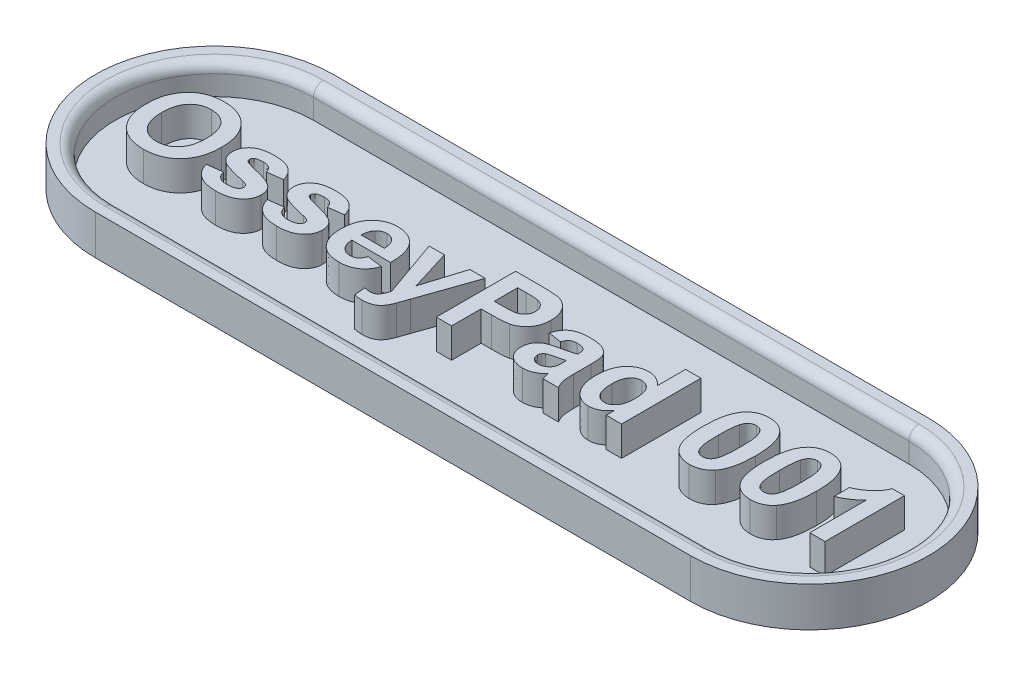
from build123d import *

# Parameters (mm, degrees)
BOSS_EXTRUDE1_DEPTH = 2
CUT_EXTRUDE1_DEPTH  = 1.5
BOSS_EXTRUDE2_DEPTH = 1.5
FILLET1_R           = 0.5


with BuildPart() as part:
    # Sketch1 → Boss-Extrude1 (new body)
    with BuildSketch(Plane(origin=(0, 0, 0), x_dir=(1, 0, 0), z_dir=(0, 1, 0))):
        with BuildLine():
            Line((-15, 6), (15, 6))
            ThreePointArc((15, 6), (21, 0), (15, -6))
            Line((15, -6), (-15, -6))
            ThreePointArc((-15, -6), (-21, 0), (-15, 6))
        make_face()
    extrude(amount=BOSS_EXTRUDE1_DEPTH)

    # Sketch2 → Cut-Extrude1 (cut)
    with BuildSketch(Plane(origin=(0, 2, 0), x_dir=(1, 0, 0), z_dir=(0, 1, 0))):
        with BuildLine():
            Line((-15, 5), (15, 5))
            ThreePointArc((15, 5), (20, 0), (15, -5))
            Line((15, -5), (-15, -5))
            ThreePointArc((-15, -5), (-20, 0), (-15, 5))
        make_face()
    extrude(amount=-CUT_EXTRUDE1_DEPTH, mode=Mode.SUBTRACT)

    # Sketch3 → Boss-Extrude2 (add)
    # profile 1 of 11: a face of its own
    with BuildSketch(Plane(origin=(0, 0.5, 0), x_dir=(1, 0, 0), z_dir=(0, 1, 0))):
        with BuildLine():
            add(Edge.make_bspline(
                [(-18.435897436, -0.019038462), (-18.435614372, 0.030391888), (-18.435058472, 0.127466713), (-18.425426006, 0.269879126), (-18.412729667, 0.406386741), (-18.392053698, 0.536452624), (-18.36773121, 0.660685527), (-18.337310232, 0.779048573), (-18.300663727, 0.891126668), (-18.271511143, 0.96268732), (-18.257211538, 0.997788462)],
                knots=[0, 0, 0, 0, 1.141009212, 2.240794809, 3.294380675, 4.305229195, 5.280013876, 6.216333343, 7.125095522, 8, 8, 8, 8], degree=3))
            add(Edge.make_bspline(
                [(-18.257211538, 0.997788462), (-18.233837113, 1.047688799), (-18.187363182, 1.146902566), (-18.10105379, 1.287099593), (-18.003227182, 1.41931675), (-17.894688739, 1.542860898), (-17.778209481, 1.655872151), (-17.653239913, 1.752593511), (-17.52421983, 1.836291465), (-17.43245726, 1.87838656), (-17.387019231, 1.899230769)],
                knots=[0, 0, 0, 0, 1.031372299, 2.050613973, 3.077158538, 4.108712802, 5.127684358, 6.111366908, 7.06480644, 8, 8, 8, 8], degree=3))
            add(Edge.make_bspline(
                [(-17.387019231, 1.899230769), (-17.356176067, 1.911881947), (-17.293834169, 1.937453202), (-17.196947521, 1.969367469), (-17.09638472, 1.995296368), (-16.992873129, 2.018473783), (-16.885407739, 2.034455374), (-16.774856913, 2.047855388), (-16.660615646, 2.054878568), (-16.583341404, 2.055809135), (-16.544070513, 2.056282051)],
                knots=[0, 0, 0, 0, 0.92659354, 1.872881803, 2.832850937, 3.813025581, 4.820167273, 5.851730198, 6.908245912, 8, 8, 8, 8], degree=3))
            add(Edge.make_bspline(
                [(-16.544070513, 2.056282051), (-16.473752941, 2.054519421), (-16.336140487, 2.051069928), (-16.135127335, 2.026154655), (-15.944907861, 1.984082923), (-15.76612596, 1.923273675), (-15.597240232, 1.847260796), (-15.439562816, 1.752975475), (-15.292860348, 1.641438169), (-15.157416176, 1.51417841), (-15.035438998, 1.371417983), (-14.929207009, 1.214490481), (-14.840092733, 1.044131281), (-14.766701981, 0.860810413), (-14.710306718, 0.663929092), (-14.669561193, 0.454042839), (-14.645355053, 0.230997055), (-14.642494663, 0.077977768), (-14.641025641, -0.000608974)],
                knots=[0, 0, 0, 0, 1.064641025, 2.083517118, 3.061799897, 4.009540929, 4.938075217, 5.861300345, 6.78508344, 7.723570974, 8.670267188, 9.622657076, 10.586935816, 11.576069104, 12.607749008, 13.683335114, 14.81022093, 16, 16, 16, 16], degree=3))
            add(Edge.make_bspline(
                [(-14.641025641, -0.000608974), (-14.642460733, -0.078669488), (-14.645254589, -0.230638725), (-14.669912552, -0.451934259), (-14.708968828, -0.660290436), (-14.766728631, -0.855231293), (-14.837928977, -1.038244361), (-14.927960262, -1.207149806), (-15.031967432, -1.36418805), (-15.153771364, -1.505410123), (-15.286935934, -1.633400225), (-15.433452317, -1.743633941), (-15.589981919, -1.838047013), (-15.757946851, -1.914279558), (-15.936252349, -1.97383646), (-16.125480301, -2.016231483), (-16.325727758, -2.041050879), (-16.462804031, -2.044512896), (-16.532852564, -2.046282051)],
                knots=[0, 0, 0, 0, 1.18845052, 2.313691126, 3.386664782, 4.412527756, 5.405809582, 6.372003093, 7.321919452, 8.268293321, 9.206237639, 10.129603466, 11.054616372, 11.9847576, 12.932764752, 13.912672021, 14.933336461, 16, 16, 16, 16], degree=3))
            add(Edge.make_bspline(
                [(-16.532852564, -2.046282051), (-16.603701235, -2.044508814), (-16.742372437, -2.041038078), (-16.94475572, -2.01629423), (-17.135862082, -1.973885252), (-17.315555438, -1.914118857), (-17.48506133, -1.839044378), (-17.642814776, -1.745596071), (-17.788902977, -1.634664224), (-17.923180215, -1.508180678), (-18.044908831, -1.367373801), (-18.148768325, -1.211345269), (-18.238804305, -1.044089607), (-18.310378988, -0.863073293), (-18.367820729, -0.670158752), (-18.406972441, -0.464235937), (-18.431678084, -0.245871605), (-18.434465278, -0.096031531), (-18.435897436, -0.019038462)],
                knots=[0, 0, 0, 0, 1.080878253, 2.11558926, 3.1052859, 4.062802436, 5.000434901, 5.928596448, 6.853693179, 7.793554778, 8.738606028, 9.68692032, 10.647726704, 11.63151566, 12.651483354, 13.714466703, 14.825613081, 16, 16, 16, 16], degree=3))
        make_face()
        with BuildLine():
            add(Edge.make_bspline(
                [(-17.666666667, 0.007403846), (-17.665898215, -0.047926721), (-17.664410122, -0.155073313), (-17.648559966, -0.310593997), (-17.62450608, -0.455984026), (-17.589131307, -0.591078385), (-17.544442015, -0.715974806), (-17.489688367, -0.830777762), (-17.425096639, -0.935658241), (-17.348996163, -1.028402068), (-17.266661415, -1.111204428), (-17.1777884, -1.182849353), (-17.084033397, -1.244514577), (-16.983774163, -1.293199063), (-16.879097269, -1.331835528), (-16.76918945, -1.360483053), (-16.653504218, -1.376213357), (-16.574563827, -1.378469211), (-16.534455128, -1.379615385)],
                knots=[0, 0, 0, 0, 1.313550922, 2.543666373, 3.708465049, 4.810029406, 5.85539231, 6.85404609, 7.825601258, 8.772642133, 9.696587791, 10.59409323, 11.479048685, 12.35559886, 13.234601248, 14.125357077, 15.047515647, 16, 16, 16, 16], degree=3))
            add(Edge.make_bspline(
                [(-16.534455128, -1.379615385), (-16.494341027, -1.378492434), (-16.415390001, -1.376282287), (-16.299846911, -1.360230356), (-16.189721284, -1.332810725), (-16.08546024, -1.294372249), (-15.986588573, -1.244914713), (-15.8931924, -1.184631894), (-15.80581008, -1.112661016), (-15.723564952, -1.031061566), (-15.649518611, -0.937701745), (-15.585476829, -0.832839365), (-15.530750158, -0.717340126), (-15.486056159, -0.591160819), (-15.451551967, -0.454064039), (-15.428479779, -0.305977248), (-15.412501451, -0.147323872), (-15.411019428, -0.037777837), (-15.41025641, 0.018621795)],
                knots=[0, 0, 0, 0, 0.949153107, 1.868086493, 2.754172764, 3.630100905, 4.492260106, 5.365378617, 6.254840125, 7.166615376, 8.102436631, 9.067266169, 10.06813181, 11.121736829, 12.23011542, 13.408501285, 14.665770308, 16, 16, 16, 16], degree=3))
            add(Edge.make_bspline(
                [(-15.41025641, 0.018621795), (-15.411118249, 0.074476858), (-15.41278728, 0.182645496), (-15.427322822, 0.339296022), (-15.451129355, 0.485035309), (-15.484223065, 0.619825604), (-15.527958483, 0.743688626), (-15.580195321, 0.85696309), (-15.643357078, 0.959057199), (-15.715795873, 1.049918093), (-15.795952736, 1.129893197), (-15.882465829, 1.199907974), (-15.975826687, 1.258164525), (-16.075124125, 1.307179509), (-16.181391931, 1.343543547), (-16.293550177, 1.37006717), (-16.411916263, 1.386400457), (-16.493002947, 1.388527846), (-16.534455128, 1.389615385)],
                knots=[0, 0, 0, 0, 1.332337092, 2.580197383, 3.749299508, 4.852775005, 5.886662144, 6.878700295, 7.822989687, 8.743523536, 9.644687758, 10.519443927, 11.392806431, 12.264866173, 13.155606721, 14.065961015, 15.011303331, 16, 16, 16, 16], degree=3))
            add(Edge.make_bspline(
                [(-16.534455128, 1.389615385), (-16.575912549, 1.388544575), (-16.657009482, 1.38644991), (-16.775560073, 1.369846201), (-16.888071654, 1.344112915), (-16.994324441, 1.305672486), (-17.09448679, 1.257128201), (-17.18818823, 1.196923612), (-17.276167098, 1.127027656), (-17.357042143, 1.045839945), (-17.430654676, 0.954183395), (-17.493846849, 0.850841799), (-17.54773206, 0.736943776), (-17.591941752, 0.612152179), (-17.624714805, 0.476123712), (-17.649903624, 0.32977257), (-17.66404873, 0.17221295), (-17.665775266, 0.063520944), (-17.666666667, 0.007403846)],
                knots=[0, 0, 0, 0, 0.981996942, 1.920933313, 2.83127778, 3.712125466, 4.592427284, 5.463259035, 6.34592384, 7.249932058, 8.173122297, 9.125107726, 10.113123258, 11.154048744, 12.256187849, 13.424658091, 14.670364834, 16, 16, 16, 16], degree=3))
        make_face(mode=Mode.SUBTRACT)
    # profile 2 of 11: a face of its own
    with BuildSketch(Plane(origin=(0, 0.5, 0), x_dir=(1, 0, 0), z_dir=(0, 1, 0))):
        with BuildLine():
            Line((-14.282051282, -1.123205128), (-13.512820513, -1.020641026))
            add(Edge.make_bspline(
                [(-13.512820513, -1.020641026), (-13.503588992, -1.056569262), (-13.485806776, -1.125776019), (-13.440765362, -1.219861636), (-13.384300764, -1.301338096), (-13.313151957, -1.368206503), (-13.227776206, -1.420848967), (-13.126905802, -1.455961432), (-13.011987496, -1.478973479), (-12.930147888, -1.48107304), (-12.887019231, -1.482179487)],
                knots=[0, 0, 0, 0, 1.039319445, 2.001988807, 2.911187514, 3.807680854, 4.723381073, 5.705509029, 6.790826147, 8, 8, 8, 8], degree=3))
            add(Edge.make_bspline(
                [(-12.887019231, -1.482179487), (-12.839880641, -1.481347743), (-12.75121902, -1.479783339), (-12.62828516, -1.458072396), (-12.521475317, -1.427913994), (-12.462819321, -1.391852021), (-12.435096154, -1.374807692)],
                knots=[0, 0, 0, 0, 1.198418162, 2.254070348, 3.174803892, 4, 4, 4, 4], degree=3))
            add(Edge.make_bspline(
                [(-12.435096154, -1.374807692), (-12.419283009, -1.361970451), (-12.388529775, -1.337004722), (-12.357321655, -1.286774029), (-12.336548638, -1.231639984), (-12.33442565, -1.192316164), (-12.333333333, -1.172083333)],
                knots=[0, 0, 0, 0, 1.030872991, 2.004830756, 2.973448591, 4, 4, 4, 4], degree=3))
            add(Edge.make_bspline(
                [(-12.333333333, -1.172083333), (-12.333856942, -1.158391082), (-12.334879677, -1.131646774), (-12.345581427, -1.093401245), (-12.363543317, -1.058834225), (-12.380204244, -1.039316175), (-12.388621795, -1.029455128)],
                knots=[0, 0, 0, 0, 1.045349703, 2.041822997, 3.010676005, 4, 4, 4, 4], degree=3))
            add(Edge.make_bspline(
                [(-12.388621795, -1.029455128), (-12.400894011, -1.020176849), (-12.429419818, -0.998610215), (-12.486486698, -0.974387347), (-12.560350945, -0.950824332), (-12.616066184, -0.937439697), (-12.646634615, -0.930096154)],
                knots=[0, 0, 0, 0, 0.66031085, 1.534841007, 2.647478808, 4, 4, 4, 4], degree=3))
            add(Edge.make_bspline(
                [(-12.646634615, -0.930096154), (-12.721227082, -0.913856878), (-12.863234827, -0.882940846), (-13.065131088, -0.833755569), (-13.245525882, -0.786146435), (-13.404870539, -0.739742648), (-13.542613402, -0.694923944), (-13.658764318, -0.649630758), (-13.754504942, -0.607412605), (-13.808485703, -0.574545067), (-13.832532051, -0.559903846)],
                knots=[0, 0, 0, 0, 1.469089687, 2.796825535, 3.998745421, 5.059265209, 5.990657066, 6.784841839, 7.458693894, 8, 8, 8, 8], degree=3))
            add(Edge.make_bspline(
                [(-13.832532051, -0.559903846), (-13.859964203, -0.539907491), (-13.913524548, -0.500865288), (-13.984866571, -0.433639585), (-14.045359316, -0.360546964), (-14.094819935, -0.281361418), (-14.132571634, -0.196272563), (-14.160176726, -0.105675334), (-14.176162186, -0.00918622), (-14.178365399, 0.057025188), (-14.179487179, 0.090737179)],
                knots=[0, 0, 0, 0, 1.056974227, 2.063706289, 3.045111424, 4.005796011, 4.963194591, 5.937303459, 6.949763919, 8, 8, 8, 8], degree=3))
            add(Edge.make_bspline(
                [(-14.179487179, 0.090737179), (-14.178506217, 0.121498882), (-14.176568673, 0.18225772), (-14.162944075, 0.271321), (-14.139429164, 0.356527801), (-14.106303269, 0.437978804), (-14.063838597, 0.515676427), (-14.01177776, 0.589438857), (-13.95059227, 0.658997097), (-13.880735197, 0.725331941), (-13.800596308, 0.785410533), (-13.709942495, 0.837752256), (-13.608876063, 0.881946689), (-13.497571662, 0.917352533), (-13.376215124, 0.945612476), (-13.244644555, 0.965105296), (-13.102793158, 0.977248281), (-13.004833611, 0.978640938), (-12.954326923, 0.979358974)],
                knots=[0, 0, 0, 0, 0.866638136, 1.711736386, 2.531524902, 3.351865931, 4.183724929, 5.020979167, 5.890357771, 6.790086018, 7.73080449, 8.705352504, 9.73310627, 10.832638366, 11.99182341, 13.240303911, 14.577136024, 16, 16, 16, 16], degree=3))
            add(Edge.make_bspline(
                [(-12.954326923, 0.979358974), (-12.906231226, 0.978787995), (-12.812876493, 0.977679713), (-12.67781573, 0.967920626), (-12.552139255, 0.952611043), (-12.436468928, 0.928745967), (-12.329557347, 0.9011226), (-12.232985185, 0.864147181), (-12.144787817, 0.823597147), (-12.067292993, 0.773348808), (-11.996401025, 0.718487231), (-11.932465755, 0.656484776), (-11.873956769, 0.588615274), (-11.819228994, 0.51594747), (-11.773635709, 0.43487875), (-11.731460942, 0.349008459), (-11.695237781, 0.25654036), (-11.676321498, 0.191859255), (-11.666666667, 0.158846154)],
                knots=[0, 0, 0, 0, 1.380550213, 2.679676202, 3.885648221, 5.011984379, 6.068504557, 7.051214125, 7.977245523, 8.849391706, 9.696088241, 10.547493682, 11.400830533, 12.26732929, 13.153751704, 14.065965736, 15.012872933, 16, 16, 16, 16], degree=3))
            Line((-11.666666667, 0.158846154), (-12.435897436, 0.056282051))
            add(Edge.make_bspline(
                [(-12.435897436, 0.056282051), (-12.44353246, 0.083854631), (-12.458354073, 0.137380345), (-12.494918792, 0.209843608), (-12.540535161, 0.272350335), (-12.59595556, 0.324557028), (-12.662601034, 0.367028168), (-12.742652446, 0.394753661), (-12.834391954, 0.412839487), (-12.899739602, 0.414420424), (-12.934294872, 0.41525641)],
                knots=[0, 0, 0, 0, 1.018425325, 1.977034519, 2.876390575, 3.766006025, 4.677889232, 5.672509542, 6.769243204, 8, 8, 8, 8], degree=3))
            add(Edge.make_bspline(
                [(-12.934294872, 0.41525641), (-12.977124797, 0.414699738), (-13.056725864, 0.413665142), (-13.16586366, 0.397183454), (-13.257824114, 0.374295727), (-13.307346951, 0.345273665), (-13.330128205, 0.331923077)],
                knots=[0, 0, 0, 0, 1.252081424, 2.327041614, 3.230413832, 4, 4, 4, 4], degree=3))
            add(Edge.make_bspline(
                [(-13.330128205, 0.331923077), (-13.342456433, 0.321788731), (-13.366113605, 0.302341495), (-13.391654636, 0.264654654), (-13.407877318, 0.222890209), (-13.409454378, 0.193184234), (-13.41025641, 0.178076923)],
                knots=[0, 0, 0, 0, 1.057832138, 2.029920023, 2.998093444, 4, 4, 4, 4], degree=3))
            add(Edge.make_bspline(
                [(-13.41025641, 0.178076923), (-13.40928165, 0.165135586), (-13.407337559, 0.13932501), (-13.392990107, 0.102271577), (-13.36903332, 0.068392092), (-13.347181778, 0.050453113), (-13.335737179, 0.041057692)],
                knots=[0, 0, 0, 0, 0.958252903, 1.911167308, 2.905987877, 4, 4, 4, 4], degree=3))
            add(Edge.make_bspline(
                [(-13.335737179, 0.041057692), (-13.32494537, 0.034084736), (-13.299162077, 0.01742527), (-13.249511898, -0.002773967), (-13.18505873, -0.026047872), (-13.104980233, -0.051235356), (-13.009711848, -0.079347287), (-12.89880707, -0.10890514), (-12.772311342, -0.139825148), (-12.634515803, -0.17219658), (-12.49437076, -0.205708932), (-12.361338797, -0.242193781), (-12.239728485, -0.281613621), (-12.129457938, -0.322826732), (-12.030304296, -0.366366142), (-11.942020126, -0.41061892), (-11.864871621, -0.457567942), (-11.820191691, -0.493218242), (-11.798878205, -0.510224359)],
                knots=[0, 0, 0, 0, 0.374473465, 0.894674728, 1.558250729, 2.377018991, 3.344303564, 4.458456515, 5.727543487, 7.146141891, 8.591136569, 9.934411183, 11.172377707, 12.322386231, 13.369924362, 14.332482298, 15.204550818, 16, 16, 16, 16], degree=3))
            add(Edge.make_bspline(
                [(-11.798878205, -0.510224359), (-11.779945602, -0.527644828), (-11.742536172, -0.562066393), (-11.69542515, -0.621833436), (-11.653661961, -0.685071569), (-11.621326792, -0.754462947), (-11.595250362, -0.828189433), (-11.576771333, -0.907148599), (-11.566753507, -0.991269367), (-11.564997898, -1.048928191), (-11.564102564, -1.078333333)],
                knots=[0, 0, 0, 0, 0.971012965, 1.9186502, 2.868006896, 3.82989672, 4.803792202, 5.820095146, 6.888280979, 8, 8, 8, 8], degree=3))
            add(Edge.make_bspline(
                [(-11.564102564, -1.078333333), (-11.565295587, -1.110969704), (-11.567645823, -1.175262837), (-11.582875331, -1.270113279), (-11.609989246, -1.360922238), (-11.645666238, -1.449065327), (-11.693816672, -1.532829726), (-11.751948954, -1.613022854), (-11.819518303, -1.690582731), (-11.897996412, -1.763354566), (-11.987072109, -1.829811392), (-12.085901593, -1.888678871), (-12.195218434, -1.937522003), (-12.314399095, -1.977516026), (-12.443694139, -2.008375551), (-12.582931045, -2.030888881), (-12.732147542, -2.043256241), (-12.834914261, -2.045253714), (-12.887820513, -2.046282051)],
                knots=[0, 0, 0, 0, 0.853005228, 1.680406763, 2.502135431, 3.325285981, 4.159928718, 5.020072903, 5.910500533, 6.844018396, 7.811498054, 8.809909951, 9.84399402, 10.934451331, 12.090792638, 13.314110396, 14.617253208, 16, 16, 16, 16], degree=3))
            add(Edge.make_bspline(
                [(-12.887820513, -2.046282051), (-12.936181474, -2.045452418), (-13.030366908, -2.043836665), (-13.167786588, -2.03305919), (-13.29724265, -2.0126671), (-13.419121567, -1.98570948), (-13.533495342, -1.951546885), (-13.639918269, -1.908814847), (-13.738889811, -1.858532218), (-13.829524457, -1.799749942), (-13.912359977, -1.734491454), (-13.987982542, -1.66375026), (-14.056500913, -1.587622814), (-14.116484012, -1.50536249), (-14.170071844, -1.418252796), (-14.215427969, -1.325350699), (-14.253759352, -1.226740298), (-14.27251028, -1.158120713), (-14.282051282, -1.123205128)],
                knots=[0, 0, 0, 0, 1.275954772, 2.484986887, 3.63311568, 4.730696379, 5.776212371, 6.778566547, 7.752400714, 8.700396387, 9.623767345, 10.531135067, 11.42942751, 12.321590653, 13.213503293, 14.124285009, 15.045583181, 16, 16, 16, 16], degree=3))
        make_face()
    # profile 3 of 11: a face of its own
    with BuildSketch(Plane(origin=(0, 0.5, 0), x_dir=(1, 0, 0), z_dir=(0, 1, 0))):
        with BuildLine():
            Line((-11.205128205, -1.123205128), (-10.435897436, -1.020641026))
            add(Edge.make_bspline(
                [(-10.435897436, -1.020641026), (-10.426665915, -1.056569262), (-10.408883699, -1.125776019), (-10.363842285, -1.219861636), (-10.307377687, -1.301338096), (-10.23622888, -1.368206503), (-10.150853129, -1.420848967), (-10.049982725, -1.455961432), (-9.935064419, -1.478973479), (-9.853224811, -1.48107304), (-9.810096154, -1.482179487)],
                knots=[0, 0, 0, 0, 1.039319445, 2.001988807, 2.911187514, 3.807680854, 4.723381073, 5.705509029, 6.790826147, 8, 8, 8, 8], degree=3))
            add(Edge.make_bspline(
                [(-9.810096154, -1.482179487), (-9.762957564, -1.481347743), (-9.674295943, -1.479783339), (-9.551362083, -1.458072396), (-9.44455224, -1.427913994), (-9.385896244, -1.391852021), (-9.358173077, -1.374807692)],
                knots=[0, 0, 0, 0, 1.198418162, 2.254070348, 3.174803892, 4, 4, 4, 4], degree=3))
            add(Edge.make_bspline(
                [(-9.358173077, -1.374807692), (-9.342359932, -1.361970451), (-9.311606698, -1.337004722), (-9.280398578, -1.286774029), (-9.259625561, -1.231639984), (-9.257502573, -1.192316164), (-9.256410256, -1.172083333)],
                knots=[0, 0, 0, 0, 1.030872991, 2.004830756, 2.973448591, 4, 4, 4, 4], degree=3))
            add(Edge.make_bspline(
                [(-9.256410256, -1.172083333), (-9.256933865, -1.158391082), (-9.2579566, -1.131646774), (-9.26865835, -1.093401245), (-9.28662024, -1.058834225), (-9.303281167, -1.039316175), (-9.311698718, -1.029455128)],
                knots=[0, 0, 0, 0, 1.045349703, 2.041822997, 3.010676005, 4, 4, 4, 4], degree=3))
            add(Edge.make_bspline(
                [(-9.311698718, -1.029455128), (-9.323970934, -1.020176849), (-9.352496741, -0.998610215), (-9.409563621, -0.974387347), (-9.483427868, -0.950824332), (-9.539143107, -0.937439697), (-9.569711538, -0.930096154)],
                knots=[0, 0, 0, 0, 0.66031085, 1.534841007, 2.647478808, 4, 4, 4, 4], degree=3))
            add(Edge.make_bspline(
                [(-9.569711538, -0.930096154), (-9.644304005, -0.913856878), (-9.78631175, -0.882940846), (-9.988208011, -0.833755569), (-10.168602805, -0.786146435), (-10.327947462, -0.739742648), (-10.465690325, -0.694923944), (-10.581841241, -0.649630758), (-10.677581865, -0.607412605), (-10.731562627, -0.574545067), (-10.755608974, -0.559903846)],
                knots=[0, 0, 0, 0, 1.469089687, 2.796825535, 3.998745421, 5.059265209, 5.990657066, 6.784841839, 7.458693894, 8, 8, 8, 8], degree=3))
            add(Edge.make_bspline(
                [(-10.755608974, -0.559903846), (-10.783041126, -0.539907491), (-10.836601471, -0.500865288), (-10.907943494, -0.433639585), (-10.968436239, -0.360546964), (-11.017896858, -0.281361418), (-11.055648557, -0.196272563), (-11.083253649, -0.105675334), (-11.09923911, -0.00918622), (-11.101442322, 0.057025188), (-11.102564103, 0.090737179)],
                knots=[0, 0, 0, 0, 1.056974227, 2.063706289, 3.045111424, 4.005796011, 4.963194591, 5.937303459, 6.949763919, 8, 8, 8, 8], degree=3))
            add(Edge.make_bspline(
                [(-11.102564103, 0.090737179), (-11.10158314, 0.121498882), (-11.099645596, 0.18225772), (-11.086020998, 0.271321), (-11.062506087, 0.356527801), (-11.029380192, 0.437978804), (-10.98691552, 0.515676427), (-10.934854683, 0.589438857), (-10.873669193, 0.658997097), (-10.80381212, 0.725331941), (-10.723673231, 0.785410533), (-10.633019418, 0.837752256), (-10.531952987, 0.881946689), (-10.420648585, 0.917352533), (-10.299292047, 0.945612476), (-10.167721478, 0.965105296), (-10.025870081, 0.977248281), (-9.927910534, 0.978640938), (-9.877403846, 0.979358974)],
                knots=[0, 0, 0, 0, 0.866638136, 1.711736386, 2.531524902, 3.351865931, 4.183724929, 5.020979167, 5.890357771, 6.790086018, 7.73080449, 8.705352504, 9.73310627, 10.832638366, 11.99182341, 13.240303911, 14.577136024, 16, 16, 16, 16], degree=3))
            add(Edge.make_bspline(
                [(-9.877403846, 0.979358974), (-9.829308149, 0.978787995), (-9.735953416, 0.977679713), (-9.600892653, 0.967920626), (-9.475216179, 0.952611043), (-9.359545852, 0.928745967), (-9.252634271, 0.9011226), (-9.156062108, 0.864147181), (-9.06786474, 0.823597147), (-8.990369916, 0.773348808), (-8.919477948, 0.718487231), (-8.855542678, 0.656484776), (-8.797033692, 0.588615274), (-8.742305917, 0.51594747), (-8.696712633, 0.43487875), (-8.654537865, 0.349008459), (-8.618314704, 0.25654036), (-8.599398421, 0.191859255), (-8.58974359, 0.158846154)],
                knots=[0, 0, 0, 0, 1.380550213, 2.679676202, 3.885648221, 5.011984379, 6.068504557, 7.051214125, 7.977245523, 8.849391706, 9.696088241, 10.547493682, 11.400830533, 12.26732929, 13.153751704, 14.065965736, 15.012872933, 16, 16, 16, 16], degree=3))
            Line((-8.58974359, 0.158846154), (-9.358974359, 0.056282051))
            add(Edge.make_bspline(
                [(-9.358974359, 0.056282051), (-9.366609383, 0.083854631), (-9.381430996, 0.137380345), (-9.417995715, 0.209843608), (-9.463612084, 0.272350335), (-9.519032483, 0.324557028), (-9.585677957, 0.367028168), (-9.665729369, 0.394753661), (-9.757468877, 0.412839487), (-9.822816525, 0.414420424), (-9.857371795, 0.41525641)],
                knots=[0, 0, 0, 0, 1.018425325, 1.977034519, 2.876390575, 3.766006025, 4.677889232, 5.672509542, 6.769243204, 8, 8, 8, 8], degree=3))
            add(Edge.make_bspline(
                [(-9.857371795, 0.41525641), (-9.90020172, 0.414699738), (-9.979802787, 0.413665142), (-10.088940583, 0.397183454), (-10.180901037, 0.374295727), (-10.230423874, 0.345273665), (-10.253205128, 0.331923077)],
                knots=[0, 0, 0, 0, 1.252081424, 2.327041614, 3.230413832, 4, 4, 4, 4], degree=3))
            add(Edge.make_bspline(
                [(-10.253205128, 0.331923077), (-10.265533356, 0.321788731), (-10.289190529, 0.302341495), (-10.314731559, 0.264654654), (-10.330954241, 0.222890209), (-10.332531301, 0.193184234), (-10.333333333, 0.178076923)],
                knots=[0, 0, 0, 0, 1.057832138, 2.029920023, 2.998093444, 4, 4, 4, 4], degree=3))
            add(Edge.make_bspline(
                [(-10.333333333, 0.178076923), (-10.332358573, 0.165135586), (-10.330414482, 0.13932501), (-10.31606703, 0.102271577), (-10.292110243, 0.068392092), (-10.270258701, 0.050453113), (-10.258814103, 0.041057692)],
                knots=[0, 0, 0, 0, 0.958252903, 1.911167308, 2.905987877, 4, 4, 4, 4], degree=3))
            add(Edge.make_bspline(
                [(-10.258814103, 0.041057692), (-10.248022293, 0.034084736), (-10.222239, 0.01742527), (-10.172588821, -0.002773967), (-10.108135653, -0.026047872), (-10.028057156, -0.051235356), (-9.932788771, -0.079347287), (-9.821883993, -0.10890514), (-9.695388266, -0.139825148), (-9.557592726, -0.17219658), (-9.417447683, -0.205708932), (-9.28441572, -0.242193781), (-9.162805408, -0.281613621), (-9.052534861, -0.322826732), (-8.953381219, -0.366366142), (-8.865097049, -0.41061892), (-8.787948544, -0.457567942), (-8.743268614, -0.493218242), (-8.721955128, -0.510224359)],
                knots=[0, 0, 0, 0, 0.374473465, 0.894674728, 1.558250729, 2.377018991, 3.344303564, 4.458456515, 5.727543487, 7.146141891, 8.591136569, 9.934411183, 11.172377707, 12.322386231, 13.369924362, 14.332482298, 15.204550818, 16, 16, 16, 16], degree=3))
            add(Edge.make_bspline(
                [(-8.721955128, -0.510224359), (-8.703022526, -0.527644828), (-8.665613095, -0.562066393), (-8.618502073, -0.621833436), (-8.576738884, -0.685071569), (-8.544403716, -0.754462947), (-8.518327285, -0.828189433), (-8.499848256, -0.907148599), (-8.48983043, -0.991269367), (-8.488074821, -1.048928191), (-8.487179487, -1.078333333)],
                knots=[0, 0, 0, 0, 0.971012965, 1.9186502, 2.868006896, 3.82989672, 4.803792202, 5.820095146, 6.888280979, 8, 8, 8, 8], degree=3))
            add(Edge.make_bspline(
                [(-8.487179487, -1.078333333), (-8.48837251, -1.110969704), (-8.490722746, -1.175262837), (-8.505952254, -1.270113279), (-8.533066169, -1.360922238), (-8.568743161, -1.449065327), (-8.616893595, -1.532829726), (-8.675025877, -1.613022854), (-8.742595226, -1.690582731), (-8.821073335, -1.763354566), (-8.910149032, -1.829811392), (-9.008978516, -1.888678871), (-9.118295357, -1.937522003), (-9.237476018, -1.977516026), (-9.366771062, -2.008375551), (-9.506007968, -2.030888881), (-9.655224465, -2.043256241), (-9.757991184, -2.045253714), (-9.810897436, -2.046282051)],
                knots=[0, 0, 0, 0, 0.853005228, 1.680406763, 2.502135431, 3.325285981, 4.159928718, 5.020072903, 5.910500533, 6.844018396, 7.811498054, 8.809909951, 9.84399402, 10.934451331, 12.090792638, 13.314110396, 14.617253208, 16, 16, 16, 16], degree=3))
            add(Edge.make_bspline(
                [(-9.810897436, -2.046282051), (-9.859258397, -2.045452418), (-9.953443831, -2.043836665), (-10.090863511, -2.03305919), (-10.220319573, -2.0126671), (-10.34219849, -1.98570948), (-10.456572265, -1.951546885), (-10.562995193, -1.908814847), (-10.661966734, -1.858532218), (-10.75260138, -1.799749942), (-10.8354369, -1.734491454), (-10.911059465, -1.66375026), (-10.979577836, -1.587622814), (-11.039560935, -1.50536249), (-11.093148767, -1.418252796), (-11.138504892, -1.325350699), (-11.176836275, -1.226740298), (-11.195587203, -1.158120713), (-11.205128205, -1.123205128)],
                knots=[0, 0, 0, 0, 1.275954772, 2.484986887, 3.63311568, 4.730696379, 5.776212371, 6.778566547, 7.752400714, 8.700396387, 9.623767345, 10.531135067, 11.42942751, 12.321590653, 13.213503293, 14.124285009, 15.045583181, 16, 16, 16, 16], degree=3))
        make_face()
    # profile 4 of 11: a face of its own
    with BuildSketch(Plane(origin=(0, 0.5, 0), x_dir=(1, 0, 0), z_dir=(0, 1, 0))):
        with BuildLine():
            Line((-6.179487179, -1.071923077), (-5.41025641, -1.174487179))
            add(Edge.make_bspline(
                [(-5.41025641, -1.174487179), (-5.422838254, -1.20914502), (-5.447576842, -1.277289721), (-5.492774404, -1.374455858), (-5.543296381, -1.465142319), (-5.598899889, -1.549833641), (-5.659377993, -1.62864032), (-5.726730472, -1.699904598), (-5.797676228, -1.766279406), (-5.875182892, -1.824604191), (-5.957308426, -1.87705751), (-6.044465549, -1.922953609), (-6.137351275, -1.960331891), (-6.234559014, -1.991633673), (-6.336530004, -2.016618795), (-6.443680264, -2.034085851), (-6.555872325, -2.04469832), (-6.632454789, -2.045747489), (-6.671474359, -2.046282051)],
                knots=[0, 0, 0, 0, 1.071172907, 2.106154283, 3.1104349, 4.085737425, 5.048416355, 5.993087888, 6.932482331, 7.868664062, 8.80754521, 9.762367971, 10.726735429, 11.713584758, 12.728370439, 13.774815933, 14.866245336, 16, 16, 16, 16], degree=3))
            add(Edge.make_bspline(
                [(-6.671474359, -2.046282051), (-6.73244897, -2.044777084), (-6.850857026, -2.041854553), (-7.022165966, -2.018368995), (-7.181275551, -1.980131589), (-7.32849222, -1.926572657), (-7.463326656, -1.856316779), (-7.585981892, -1.770887167), (-7.696698473, -1.670098154), (-7.758755291, -1.592062658), (-7.790064103, -1.552692308)],
                knots=[0, 0, 0, 0, 1.150944905, 2.235047425, 3.25761485, 4.235688044, 5.185329112, 6.119879054, 7.051444229, 8, 8, 8, 8], degree=3))
            add(Edge.make_bspline(
                [(-7.790064103, -1.552692308), (-7.813170014, -1.519188378), (-7.859698573, -1.451721244), (-7.917535282, -1.34240076), (-7.966990504, -1.226915415), (-8.006389648, -1.10493441), (-8.039141254, -0.976921214), (-8.061176981, -0.842062561), (-8.073877703, -0.700641464), (-8.075894219, -0.604267599), (-8.076923077, -0.555096154)],
                knots=[0, 0, 0, 0, 0.92479112, 1.862259343, 2.806490716, 3.778329015, 4.774107667, 5.808532634, 6.881879269, 8, 8, 8, 8], degree=3))
            add(Edge.make_bspline(
                [(-8.076923077, -0.555096154), (-8.076076915, -0.49680785), (-8.07442276, -0.382860481), (-8.054838894, -0.217220041), (-8.027204936, -0.060584792), (-7.985061289, 0.085417992), (-7.932387367, 0.22245377), (-7.866279548, 0.34876033), (-7.790026011, 0.466635164), (-7.7008682, 0.572518319), (-7.603162134, 0.667723886), (-7.499184551, 0.751615965), (-7.388157067, 0.821688048), (-7.271733408, 0.880173442), (-7.14797637, 0.923951058), (-7.018434887, 0.956177131), (-6.882542557, 0.975802375), (-6.789861762, 0.978161007), (-6.742788462, 0.979358974)],
                knots=[0, 0, 0, 0, 1.222152375, 2.389176539, 3.494777592, 4.555389183, 5.572001132, 6.56945427, 7.540785438, 8.511469914, 9.46642023, 10.399267108, 11.30862844, 12.215760073, 13.126777173, 14.056336669, 15.012798191, 16, 16, 16, 16], degree=3))
            add(Edge.make_bspline(
                [(-6.742788462, 0.979358974), (-6.690103883, 0.978245071), (-6.587005685, 0.976065279), (-6.436688886, 0.9556016), (-6.294763964, 0.922316944), (-6.161694515, 0.874488801), (-6.036612813, 0.814514631), (-5.920449133, 0.740188756), (-5.813197512, 0.652189942), (-5.715122809, 0.55055571), (-5.626363532, 0.43595435), (-5.550815549, 0.306175293), (-5.487571448, 0.162559914), (-5.436298601, 0.004737951), (-5.398393184, -0.167620997), (-5.372456715, -0.354068383), (-5.357665573, -0.554587098), (-5.358529001, -0.692892511), (-5.358974359, -0.764230769)],
                knots=[0, 0, 0, 0, 0.994942504, 1.946998194, 2.860087576, 3.744358974, 4.613292, 5.475605888, 6.343365869, 7.228414471, 8.138836547, 9.075277299, 10.058013037, 11.098483422, 12.205225682, 13.387753975, 14.652597341, 16, 16, 16, 16], degree=3))
            Line((-5.358974359, -0.764230769), (-7.307692308, -0.764230769))
            add(Edge.make_bspline(
                [(-7.307692308, -0.764230769), (-7.306430775, -0.791763508), (-7.303974166, -0.845378582), (-7.294668746, -0.923749334), (-7.278559473, -0.997107978), (-7.257477652, -1.065899573), (-7.232409314, -1.130172389), (-7.200520404, -1.189309247), (-7.16378028, -1.244064576), (-7.121306381, -1.293545478), (-7.074800926, -1.33746997), (-7.0257272, -1.376071275), (-6.974160527, -1.409825053), (-6.918768647, -1.435496954), (-6.861393173, -1.45717398), (-6.801001234, -1.47106864), (-6.737997051, -1.480301614), (-6.69501317, -1.481544961), (-6.673076923, -1.482179487)],
                knots=[0, 0, 0, 0, 1.231756261, 2.398624542, 3.522625857, 4.583815436, 5.612473245, 6.600564899, 7.580690863, 8.554470542, 9.508734211, 10.435415665, 11.342824763, 12.255949018, 13.158633635, 14.07945191, 15.019874036, 16, 16, 16, 16], degree=3))
            add(Edge.make_bspline(
                [(-6.673076923, -1.482179487), (-6.64387994, -1.48088488), (-6.587329742, -1.47837742), (-6.505816434, -1.460808928), (-6.431856781, -1.429848571), (-6.364675803, -1.38668616), (-6.304898113, -1.329366423), (-6.254780714, -1.256358155), (-6.210961635, -1.169940595), (-6.190323861, -1.10567059), (-6.179487179, -1.071923077)],
                knots=[0, 0, 0, 0, 1.004430367, 1.945431754, 2.851730883, 3.749038912, 4.678525969, 5.68064125, 6.782128749, 8, 8, 8, 8], degree=3))
        make_face()
        with BuildLine():
            add(Edge.make_bspline(
                [(-6.128205128, -0.302692308), (-6.129529022, -0.27436421), (-6.132107398, -0.219193261), (-6.140517974, -0.138754154), (-6.154956078, -0.063779133), (-6.173946423, 0.006136145), (-6.19928545, 0.070130996), (-6.227575235, 0.130039606), (-6.262269047, 0.183996564), (-6.302011352, 0.231877901), (-6.343933295, 0.275642987), (-6.390274279, 0.312036491), (-6.437130475, 0.344605938), (-6.486925478, 0.370666995), (-6.539143428, 0.390577661), (-6.593608472, 0.405216492), (-6.650415746, 0.413060596), (-6.688813985, 0.414516378), (-6.708333333, 0.41525641)],
                knots=[0, 0, 0, 0, 1.317025077, 2.564998298, 3.752245872, 4.859831213, 5.924126069, 6.944952788, 7.932526842, 8.893486968, 9.832088588, 10.740700482, 11.624936399, 12.479435602, 13.343337491, 14.21592381, 15.09308328, 16, 16, 16, 16], degree=3))
            add(Edge.make_bspline(
                [(-6.708333333, 0.41525641), (-6.729193143, 0.414579294), (-6.770298439, 0.413245004), (-6.830578131, 0.404539004), (-6.887714451, 0.389097395), (-6.942142836, 0.368197959), (-6.993746644, 0.340675591), (-7.042527028, 0.3069228), (-7.088667506, 0.267362169), (-7.116469259, 0.237390667), (-7.130608974, 0.222147436)],
                knots=[0, 0, 0, 0, 1.043516863, 2.056302107, 3.038302912, 3.998520634, 4.966791607, 5.956307719, 6.960596886, 8, 8, 8, 8], degree=3))
            add(Edge.make_bspline(
                [(-7.130608974, 0.222147436), (-7.143788139, 0.20557584), (-7.170266724, 0.172281439), (-7.203849377, 0.117077998), (-7.2331022, 0.058071984), (-7.25490191, -0.006329707), (-7.274046479, -0.074039953), (-7.285276565, -0.146676948), (-7.29284166, -0.223201483), (-7.293653159, -0.275694916), (-7.294070513, -0.302692308)],
                knots=[0, 0, 0, 0, 0.903873942, 1.815995408, 2.755131859, 3.711650387, 4.716574161, 5.757841734, 6.846857195, 8, 8, 8, 8], degree=3))
            Line((-7.294070513, -0.302692308), (-6.128205128, -0.302692308))
        make_face(mode=Mode.SUBTRACT)
    # profile 5 of 11: a face of its own
    with BuildSketch(Plane(origin=(0, 0.5, 0), x_dir=(1, 0, 0), z_dir=(0, 1, 0))):
        with BuildLine():
            Line((-5.102564103, 0.928076923), (-4.333333333, 0.928076923))
            Line((-4.333333333, 0.928076923), (-3.692307692, -1.141634615))
            Line((-3.692307692, -1.141634615), (-3.051282051, 0.928076923))
            Line((-3.051282051, 0.928076923), (-2.282051282, 0.928076923))
            Line((-2.282051282, 0.928076923), (-3.25400641, -1.859583333))
            Line((-3.25400641, -1.859583333), (-3.438301282, -2.387628205))
            add(Edge.make_bspline(
                [(-3.438301282, -2.387628205), (-3.453456537, -2.425433559), (-3.481955479, -2.496525243), (-3.527377153, -2.595048236), (-3.570270905, -2.680032392), (-3.614950884, -2.751152619), (-3.65860382, -2.813347921), (-3.706447973, -2.866730369), (-3.756200941, -2.915660081), (-3.810255711, -2.958249565), (-3.869204212, -2.996023695), (-3.934189839, -3.02829271), (-4.005183048, -3.057739725), (-4.082622109, -3.080954513), (-4.16540167, -3.100958742), (-4.253787045, -3.112508809), (-4.347000031, -3.122486853), (-4.411026321, -3.1229614), (-4.443910256, -3.123205128)],
                knots=[0, 0, 0, 0, 1.442389574, 2.712364636, 3.842141792, 4.810870158, 5.685193676, 6.529785669, 7.346031511, 8.154233153, 8.962545531, 9.821428725, 10.720930479, 11.681493955, 12.682037037, 13.733651981, 14.836002494, 16, 16, 16, 16], degree=3))
            add(Edge.make_bspline(
                [(-4.443910256, -3.123205128), (-4.51167732, -3.121551977), (-4.646906127, -3.118253122), (-4.779837985, -3.093223656), (-4.846153846, -3.080737179)],
                knots=[0, 0, 0, 0, 1.002257816, 2, 2, 2, 2], degree=3))
            Line((-4.846153846, -3.080737179), (-4.897435897, -2.523044872))
            add(Edge.make_bspline(
                [(-4.897435897, -2.523044872), (-4.871045551, -2.528661351), (-4.820081387, -2.539507709), (-4.744920908, -2.550843403), (-4.67372872, -2.557389476), (-4.627415917, -2.558543301), (-4.604967949, -2.559102564)],
                knots=[0, 0, 0, 0, 1.096454798, 2.117437249, 3.087515614, 4, 4, 4, 4], degree=3))
            add(Edge.make_bspline(
                [(-4.604967949, -2.559102564), (-4.585448017, -2.55866928), (-4.547866863, -2.557835092), (-4.493278414, -2.550632323), (-4.442750478, -2.537863287), (-4.396168166, -2.520008384), (-4.352850548, -2.498612294), (-4.314003999, -2.470696751), (-4.278879333, -2.438189335), (-4.237571333, -2.386996495), (-4.192014185, -2.314596413), (-4.145094126, -2.217843648), (-4.103775694, -2.110670578), (-4.082920852, -2.03447765), (-4.072115385, -1.995)],
                knots=[0, 0, 0, 0, 0.826282398, 1.5908173, 2.325927711, 3.027474672, 3.700169566, 4.365407898, 5.04557163, 5.720354759, 7.144619778, 8.656909909, 10.267853154, 12, 12, 12, 12], degree=3))
            Line((-4.072115385, -1.995), (-5.102564103, 0.928076923))
        make_face()
    # profile 6 of 11: a face of its own
    with BuildSketch(Plane(origin=(0, 0.5, 0), x_dir=(1, 0, 0), z_dir=(0, 1, 0))):
        with BuildLine():
            Line((-1.820512821, -1.995), (-1.820512821, 2.005))
            Line((-1.820512821, 2.005), (-0.540865385, 2.005))
            add(Edge.make_bspline(
                [(-0.540865385, 2.005), (-0.482904088, 2.004936704), (-0.372046219, 2.004815641), (-0.213914173, 2.001452031), (-0.071539957, 1.99669047), (0.054865123, 1.990760147), (0.165745855, 1.981910965), (0.260604839, 1.971663747), (0.340039396, 1.960640459), (0.386816053, 1.94923283), (0.407852564, 1.944102564)],
                knots=[0, 0, 0, 0, 1.460485487, 2.793352117, 3.985295279, 5.050041172, 5.981765236, 6.787433016, 7.454681457, 8, 8, 8, 8], degree=3))
            add(Edge.make_bspline(
                [(0.407852564, 1.944102564), (0.435826008, 1.936126257), (0.491346741, 1.920295157), (0.570890637, 1.886545765), (0.647558357, 1.847432021), (0.720386654, 1.800815508), (0.789623093, 1.747523834), (0.855473477, 1.6879916), (0.918288976, 1.621950063), (0.977200619, 1.549529687), (1.031156753, 1.471095651), (1.077788411, 1.386531993), (1.116855989, 1.296206269), (1.150140917, 1.200797267), (1.174698695, 1.099282048), (1.191884675, 0.992365949), (1.203848261, 0.880002209), (1.20469532, 0.80310963), (1.205128205, 0.763814103)],
                knots=[0, 0, 0, 0, 0.907145743, 1.80047177, 2.69161667, 3.591261238, 4.495029544, 5.415863088, 6.359363025, 7.337192411, 8.326890979, 9.326929023, 10.346104993, 11.395420813, 12.477187422, 13.601053412, 14.774031606, 16, 16, 16, 16], degree=3))
            add(Edge.make_bspline(
                [(1.205128205, 0.763814103), (1.20389362, 0.704139376), (1.201516976, 0.589262252), (1.174926543, 0.42457197), (1.134369593, 0.274138014), (1.075092679, 0.139409376), (1.002821807, 0.019857357), (0.923213954, -0.087918223), (0.832313485, -0.180668899), (0.734103546, -0.259891497), (0.63031359, -0.324723985), (0.526335754, -0.37999276), (0.420767007, -0.422485161), (0.348790471, -0.440999441), (0.313301282, -0.450128205)],
                knots=[0, 0, 0, 0, 1.312386234, 2.526415563, 3.661883817, 4.733421185, 5.753802465, 6.732107337, 7.675884281, 8.604170108, 9.50284679, 10.365392406, 11.194030444, 12, 12, 12, 12], degree=3))
            add(Edge.make_bspline(
                [(0.313301282, -0.450128205), (0.28797084, -0.454946651), (0.23457729, -0.465103359), (0.149898314, -0.475227748), (0.057339603, -0.486434343), (-0.043479541, -0.493743914), (-0.152437155, -0.500589021), (-0.26949093, -0.503820822), (-0.394473583, -0.507714485), (-0.480498279, -0.50778445), (-0.524839744, -0.507820513)],
                knots=[0, 0, 0, 0, 0.735353946, 1.55003838, 2.431865514, 3.394945452, 4.432993119, 5.54609699, 6.735134699, 8, 8, 8, 8], degree=3))
            Line((-0.524839744, -0.507820513), (-1.051282051, -0.507820513))
            Line((-1.051282051, -0.507820513), (-1.051282051, -1.995))
            Line((-1.051282051, -1.995), (-1.820512821, -1.995))
        make_face()
        with BuildLine():
            Line((-1.051282051, 1.338333333), (-1.051282051, 0.158846154))
            Line((-1.051282051, 0.158846154), (-0.58974359, 0.158846154))
            add(Edge.make_bspline(
                [(-0.58974359, 0.158846154), (-0.549943086, 0.158897692), (-0.473799714, 0.158996291), (-0.364550866, 0.162535426), (-0.265658705, 0.166855596), (-0.1769166, 0.174006361), (-0.098860221, 0.183430898), (-0.030966844, 0.194703832), (0.026842659, 0.206800867), (0.089355767, 0.226847594), (0.156194777, 0.259281369), (0.227570985, 0.305896851), (0.2902749, 0.361631158), (0.342452868, 0.427089171), (0.384131512, 0.499816815), (0.413973452, 0.579068755), (0.433242364, 0.663531508), (0.435002404, 0.722041046), (0.435897436, 0.751794872)],
                knots=[0, 0, 0, 0, 1.411705958, 2.700771114, 3.876961699, 4.922619712, 5.858038221, 6.66485904, 7.363650596, 7.950905807, 8.989198271, 9.987739806, 10.967313358, 11.951275539, 12.944273208, 13.927870418, 14.946261014, 16, 16, 16, 16], degree=3))
            add(Edge.make_bspline(
                [(0.435897436, 0.751794872), (0.434637777, 0.788034566), (0.432195463, 0.858298556), (0.405263565, 0.958366204), (0.363710723, 1.049178808), (0.304301956, 1.127910777), (0.232537565, 1.194117889), (0.151877383, 1.249204559), (0.060598878, 1.287754631), (-0.004001838, 1.302691361), (-0.036858974, 1.310288462)],
                knots=[0, 0, 0, 0, 1.085904563, 2.105425768, 3.088705091, 4.068969419, 5.045188284, 6.010769642, 6.988240112, 8, 8, 8, 8], degree=3))
            add(Edge.make_bspline(
                [(-0.036858974, 1.310288462), (-0.050998151, 1.312549908), (-0.082382739, 1.317569616), (-0.134550311, 1.322808307), (-0.196264557, 1.327572891), (-0.267599868, 1.331484756), (-0.348273487, 1.33454293), (-0.438551514, 1.337222643), (-0.538196183, 1.337437923), (-0.607906635, 1.338026594), (-0.644230769, 1.338333333)],
                knots=[0, 0, 0, 0, 0.564603001, 1.253243608, 2.066786758, 3.005752288, 4.070476343, 5.250658742, 6.567396469, 8, 8, 8, 8], degree=3))
            Line((-0.644230769, 1.338333333), (-1.051282051, 1.338333333))
        make_face(mode=Mode.SUBTRACT)
    # profile 7 of 11: a face of its own
    with BuildSketch(Plane(origin=(0, 0.5, 0), x_dir=(1, 0, 0), z_dir=(0, 1, 0))):
        with BuildLine():
            Line((2.384615385, 0.056282051), (1.717948718, 0.158846154))
            add(Edge.make_bspline(
                [(1.717948718, 0.158846154), (1.727939679, 0.192636215), (1.747496781, 0.258779572), (1.783384379, 0.353563601), (1.825408393, 0.441191354), (1.87175492, 0.522709688), (1.923852054, 0.597227449), (1.980867125, 0.664938486), (2.043122358, 0.725611059), (2.110915284, 0.779714879), (2.185550169, 0.827777413), (2.268721238, 0.868524876), (2.36030384, 0.90283482), (2.46016939, 0.930407994), (2.568150339, 0.953460233), (2.685073192, 0.967572466), (2.810183814, 0.977759307), (2.896344251, 0.978815288), (2.940705128, 0.979358974)],
                knots=[0, 0, 0, 0, 1.047140172, 2.049755565, 3.008539736, 3.933190086, 4.833981818, 5.707167246, 6.560530269, 7.413560864, 8.281243119, 9.193714071, 10.161006392, 11.183910126, 12.270717139, 13.439589873, 14.681737877, 16, 16, 16, 16], degree=3))
            add(Edge.make_bspline(
                [(2.940705128, 0.979358974), (2.981043588, 0.979135013), (3.059092168, 0.978701682), (3.172161508, 0.973020535), (3.277266877, 0.96370503), (3.374270757, 0.949935065), (3.463492856, 0.933560285), (3.544648226, 0.912795274), (3.617978478, 0.888290248), (3.702706815, 0.850197668), (3.795775917, 0.796667912), (3.892913632, 0.723983807), (3.970847313, 0.641302036), (4.02242457, 0.564133761), (4.052884031, 0.494189354), (4.074377269, 0.432564215), (4.089820305, 0.360561538), (4.1050199, 0.279212234), (4.114347415, 0.188076146), (4.122765237, 0.087130903), (4.127324224, -0.023538347), (4.127904216, -0.100766005), (4.128205128, -0.140833333)],
                knots=[0, 0, 0, 0, 1.253259065, 2.424859341, 3.516580225, 4.530621704, 5.468151732, 6.333678254, 7.13150538, 7.867126506, 9.216626747, 10.459871386, 11.622324159, 12.731817101, 13.322505456, 13.989117254, 14.756090433, 15.607496751, 16.559714447, 17.600403876, 18.755039204, 20, 20, 20, 20], degree=3))
            Line((4.128205128, -0.140833333), (4.128205128, -1.039070513))
            add(Edge.make_bspline(
                [(4.128205128, -1.039070513), (4.128454299, -1.070052444), (4.128935489, -1.129883496), (4.129921885, -1.216471257), (4.134388349, -1.29658049), (4.139080965, -1.370309901), (4.144487269, -1.437947156), (4.151503045, -1.499180029), (4.160282198, -1.554273628), (4.174367146, -1.620072002), (4.197023573, -1.699903227), (4.234067161, -1.795593414), (4.278503955, -1.89526334), (4.314675738, -1.961061146), (4.333333333, -1.995)],
                knots=[0, 0, 0, 0, 1.124218554, 2.171045354, 3.141373911, 4.034856482, 4.851737235, 5.603038048, 6.270604849, 6.87504238, 8.043824301, 9.276776929, 10.59534724, 12, 12, 12, 12], degree=3))
            Line((4.333333333, -1.995), (3.564102564, -1.995))
            add(Edge.make_bspline(
                [(3.564102564, -1.995), (3.558612118, -1.979556555), (3.546581426, -1.945716803), (3.530333934, -1.888992345), (3.510862375, -1.822901474), (3.498024618, -1.775212033), (3.491185897, -1.749807692)],
                knots=[0, 0, 0, 0, 0.768508203, 1.683958961, 2.766236402, 4, 4, 4, 4], degree=3))
            add(Edge.make_bspline(
                [(3.491185897, -1.749807692), (3.488237577, -1.738592441), (3.482900874, -1.718291913), (3.475789208, -1.69068109), (3.469623797, -1.669571757), (3.465572963, -1.657651172), (3.463942308, -1.652852564)],
                knots=[0, 0, 0, 0, 1.381357368, 2.500370598, 3.396327181, 4, 4, 4, 4], degree=3))
            add(Edge.make_bspline(
                [(3.463942308, -1.652852564), (3.431400502, -1.684226412), (3.367721655, -1.745619762), (3.263866646, -1.825130329), (3.157763276, -1.893578924), (3.047687878, -1.949440812), (2.934468226, -1.993099558), (2.816983444, -2.023544177), (2.695861572, -2.042487708), (2.613583621, -2.045010539), (2.572115385, -2.046282051)],
                knots=[0, 0, 0, 0, 1.082260538, 2.117802027, 3.127898709, 4.103827344, 5.070056335, 6.029309159, 7.006768236, 8, 8, 8, 8], degree=3))
            add(Edge.make_bspline(
                [(2.572115385, -2.046282051), (2.536035229, -2.045446916), (2.465565305, -2.043815772), (2.362734494, -2.033040779), (2.266074908, -2.012604899), (2.175143828, -1.985426049), (2.089720748, -1.951256937), (2.010543736, -1.908326427), (1.937148299, -1.857597056), (1.870262942, -1.799254558), (1.810316168, -1.735220696), (1.757706123, -1.667088991), (1.714184425, -1.593945769), (1.678179124, -1.517201023), (1.649691671, -1.436182873), (1.630041248, -1.351259887), (1.61751543, -1.262198986), (1.616105419, -1.201506861), (1.615384615, -1.170480769)],
                knots=[0, 0, 0, 0, 1.186431605, 2.317277787, 3.39378889, 4.430144672, 5.434756152, 6.413230964, 7.385260177, 8.362630794, 9.325691837, 10.265445477, 11.187216893, 12.118354241, 13.048828682, 14.005299944, 14.980300216, 16, 16, 16, 16], degree=3))
            add(Edge.make_bspline(
                [(1.615384615, -1.170480769), (1.616693774, -1.129777325), (1.619262596, -1.049909339), (1.641705552, -0.933876876), (1.676850126, -0.824273278), (1.726801419, -0.722473415), (1.788955834, -0.629388657), (1.863728239, -0.547225063), (1.950041003, -0.477265688), (2.049778955, -0.417854231), (2.16675527, -0.367807245), (2.303367913, -0.319594552), (2.462943064, -0.276384636), (2.577333026, -0.25166243), (2.637820513, -0.238589744)],
                knots=[0, 0, 0, 0, 0.9565892, 1.877012003, 2.769038917, 3.656897043, 4.535078379, 5.39337207, 6.259743944, 7.138913465, 8.11486349, 9.247429708, 10.544487161, 12, 12, 12, 12], degree=3))
            add(Edge.make_bspline(
                [(2.637820513, -0.238589744), (2.679500673, -0.230108451), (2.759733514, -0.21378226), (2.874984155, -0.189235212), (2.980274665, -0.164493682), (3.07515822, -0.13935931), (3.160638213, -0.116523087), (3.235822503, -0.093511424), (3.301007767, -0.070351347), (3.340603626, -0.053910076), (3.358974359, -0.046282051)],
                knots=[0, 0, 0, 0, 1.365613701, 2.628758346, 3.783158308, 4.837685682, 5.780080249, 6.623655076, 7.36143661, 8, 8, 8, 8], degree=3))
            Line((3.358974359, -0.046282051), (3.358974359, 0.026634615))
            add(Edge.make_bspline(
                [(3.358974359, 0.026634615), (3.357949334, 0.059324168), (3.356045804, 0.120030526), (3.337121559, 0.20420859), (3.304271102, 0.273542577), (3.264618594, 0.319753249), (3.225386348, 0.347629678), (3.190744614, 0.366182393), (3.150150864, 0.380988799), (3.104175305, 0.394112042), (3.052027778, 0.403079666), (2.994310259, 0.410526007), (2.930868026, 0.414179766), (2.886755175, 0.414887721), (2.863782051, 0.41525641)],
                knots=[0, 0, 0, 0, 1.600506204, 2.972230995, 4.195852174, 5.327580964, 5.908906329, 6.547275261, 7.247479517, 8.022494018, 8.887774365, 9.837646189, 10.873887764, 12, 12, 12, 12], degree=3))
            add(Edge.make_bspline(
                [(2.863782051, 0.41525641), (2.83325523, 0.414526972), (2.775246358, 0.413140852), (2.693498059, 0.397631942), (2.621566472, 0.37332102), (2.559216959, 0.337025356), (2.505466961, 0.2877181), (2.458663736, 0.224134958), (2.417201232, 0.145999077), (2.395885958, 0.087312773), (2.384615385, 0.056282051)],
                knots=[0, 0, 0, 0, 1.120680009, 2.129582446, 3.045508635, 3.899130849, 4.760899303, 5.707254252, 6.787697471, 8, 8, 8, 8], degree=3))
        make_face()
        with BuildLine():
            add(Edge.make_bspline(
                [(3.358974359, -0.610384615), (3.332573461, -0.618537456), (3.273111605, -0.636899826), (3.173232958, -0.663878155), (3.052843698, -0.692307188), (2.941824674, -0.716906417), (2.849147576, -0.736885805), (2.783770229, -0.753221396), (2.724857254, -0.768797855), (2.672320557, -0.785155565), (2.626089823, -0.800553548), (2.5868381, -0.817052855), (2.553199162, -0.831500397), (2.534331528, -0.84359558), (2.525641026, -0.849166667)],
                knots=[0, 0, 0, 0, 1.144223484, 2.577096135, 4.283377528, 6.266557578, 7.286341447, 8.209198618, 9.057088726, 9.80932547, 10.487940513, 11.073343897, 11.57317876, 12, 12, 12, 12], degree=3))
            add(Edge.make_bspline(
                [(2.525641026, -0.849166667), (2.504126674, -0.866111475), (2.462837978, -0.898630653), (2.417828514, -0.961473268), (2.38926718, -1.031143624), (2.386184971, -1.080462005), (2.384615385, -1.105576923)],
                knots=[0, 0, 0, 0, 1.075028234, 2.063111864, 3.013658082, 4, 4, 4, 4], degree=3))
            add(Edge.make_bspline(
                [(2.384615385, -1.105576923), (2.385999765, -1.13056573), (2.388715332, -1.179583165), (2.41034491, -1.250215357), (2.446717209, -1.314925317), (2.496255799, -1.372451934), (2.555865713, -1.422255007), (2.626132097, -1.456390387), (2.70354423, -1.478432019), (2.757852386, -1.480898503), (2.786057692, -1.482179487)],
                knots=[0, 0, 0, 0, 0.976809721, 1.916086158, 2.861451878, 3.862738809, 4.873423621, 5.878632484, 6.898253484, 8, 8, 8, 8], degree=3))
            add(Edge.make_bspline(
                [(2.786057692, -1.482179487), (2.818287112, -1.480721159), (2.883171023, -1.477785269), (2.978331824, -1.450960065), (3.072285107, -1.41136645), (3.129332935, -1.372399608), (3.158653846, -1.352371795)],
                knots=[0, 0, 0, 0, 0.962503947, 1.937702252, 2.940039444, 4, 4, 4, 4], degree=3))
            add(Edge.make_bspline(
                [(3.158653846, -1.352371795), (3.179361356, -1.335700932), (3.219623779, -1.303287118), (3.267610933, -1.244053982), (3.307210971, -1.181044051), (3.322993213, -1.134560608), (3.330929487, -1.111185897)],
                knots=[0, 0, 0, 0, 1.055399509, 2.052054707, 3.020454315, 4, 4, 4, 4], degree=3))
            add(Edge.make_bspline(
                [(3.330929487, -1.111185897), (3.335303465, -1.092017055), (3.345542374, -1.047145308), (3.352766172, -0.968150608), (3.358609771, -0.868760051), (3.358845434, -0.795496943), (3.358974359, -0.755416667)],
                knots=[0, 0, 0, 0, 0.659054705, 1.542760655, 2.655710416, 4, 4, 4, 4], degree=3))
            Line((3.358974359, -0.755416667), (3.358974359, -0.610384615))
        make_face(mode=Mode.SUBTRACT)
    # profile 8 of 11: a face of its own
    with BuildSketch(Plane(origin=(0, 0.5, 0), x_dir=(1, 0, 0), z_dir=(0, 1, 0))):
        with BuildLine():
            Line((7.512820513, -1.995), (6.743589744, -1.995))
            Line((6.743589744, -1.995), (6.743589744, -1.572724359))
            add(Edge.make_bspline(
                [(6.743589744, -1.572724359), (6.71551205, -1.612042752), (6.660938674, -1.688464179), (6.563593263, -1.786397744), (6.461369062, -1.870741314), (6.349955521, -1.934748135), (6.236123454, -1.98465635), (6.120821055, -2.0202355), (6.004553107, -2.041881819), (5.926637918, -2.04481883), (5.887820513, -2.046282051)],
                knots=[0, 0, 0, 0, 1.136300101, 2.208576455, 3.242281452, 4.249058783, 5.223933999, 6.165280663, 7.085941471, 8, 8, 8, 8], degree=3))
            add(Edge.make_bspline(
                [(5.887820513, -2.046282051), (5.849293524, -2.044988805), (5.77312965, -2.042432192), (5.660752406, -2.023881361), (5.55289576, -1.991255509), (5.449040078, -1.947138755), (5.349566758, -1.890406381), (5.254577941, -1.820902442), (5.163884962, -1.738460194), (5.077581852, -1.644604624), (4.999341333, -1.538711475), (4.92994653, -1.423099855), (4.872202693, -1.296922088), (4.825096271, -1.161087962), (4.788315997, -1.015228498), (4.762006944, -0.859584369), (4.747046692, -0.694011238), (4.744762196, -0.580500005), (4.743589744, -0.52224359)],
                knots=[0, 0, 0, 0, 0.868680302, 1.717291116, 2.559594063, 3.404262612, 4.256691068, 5.136162843, 6.05305749, 7.01654586, 8.006773995, 9.017023416, 10.051895049, 11.130067211, 12.254925639, 13.440213999, 14.686262564, 16, 16, 16, 16], degree=3))
            add(Edge.make_bspline(
                [(4.743589744, -0.52224359), (4.74475545, -0.462652373), (4.747017644, -0.347008391), (4.761899325, -0.179022039), (4.788238248, -0.022299728), (4.824997396, 0.123574131), (4.872018747, 0.25868705), (4.92979087, 0.382853457), (4.998017997, 0.495957986), (5.07700463, 0.596942549), (5.16347857, 0.686926415), (5.256670942, 0.764805259), (5.355256524, 0.831079264), (5.458858331, 0.886208627), (5.568796313, 0.928005484), (5.683911806, 0.957174319), (5.804352605, 0.976798099), (5.886671922, 0.978493618), (5.928685897, 0.979358974)],
                knots=[0, 0, 0, 0, 1.327136196, 2.575468729, 3.751890053, 4.862767969, 5.921925726, 6.933145827, 7.907387355, 8.856890668, 9.782390252, 10.681851331, 11.556239068, 12.423659137, 13.289752485, 14.16837887, 15.06518071, 16, 16, 16, 16], degree=3))
            add(Edge.make_bspline(
                [(5.928685897, 0.979358974), (5.967490675, 0.978110634), (6.043943067, 0.975651178), (6.15662213, 0.956557345), (6.265176674, 0.925602428), (6.369357149, 0.880532637), (6.470162807, 0.824414488), (6.566299834, 0.754952236), (6.658690569, 0.673360033), (6.714794896, 0.611346767), (6.743589744, 0.579519231)],
                knots=[0, 0, 0, 0, 0.992399448, 1.955205421, 2.915485871, 3.87381908, 4.85285833, 5.861755538, 6.90257267, 8, 8, 8, 8], degree=3))
            Line((6.743589744, 0.579519231), (6.743589744, 2.005))
            Line((6.743589744, 2.005), (7.512820513, 2.005))
            Line((7.512820513, 2.005), (7.512820513, -1.995))
        make_face()
        with BuildLine():
            add(Edge.make_bspline(
                [(5.512820513, -0.478173077), (5.512934906, -0.516915556), (5.513155192, -0.591521768), (5.52022738, -0.699188329), (5.529101793, -0.79848261), (5.543115806, -0.889306192), (5.559090867, -0.972336313), (5.58107084, -1.046562725), (5.605169938, -1.113287932), (5.62616685, -1.153049637), (5.636217949, -1.172083333)],
                knots=[0, 0, 0, 0, 1.306099746, 2.515150209, 3.637201974, 4.666415219, 5.613193253, 6.485405436, 7.274972403, 8, 8, 8, 8], degree=3))
            add(Edge.make_bspline(
                [(5.636217949, -1.172083333), (5.651071841, -1.196835041), (5.679813885, -1.244729198), (5.732254431, -1.307363742), (5.78712225, -1.362148498), (5.848409455, -1.405627029), (5.913293117, -1.440707947), (5.983185211, -1.464590392), (6.057046566, -1.47963087), (6.107830816, -1.481316864), (6.133814103, -1.482179487)],
                knots=[0, 0, 0, 0, 1.120960711, 2.169040953, 3.168100815, 4.128109154, 5.080726846, 6.026866003, 6.990464429, 8, 8, 8, 8], degree=3))
            add(Edge.make_bspline(
                [(6.133814103, -1.482179487), (6.154680995, -1.481276505), (6.195869678, -1.479494129), (6.256401436, -1.469348915), (6.314110973, -1.450287682), (6.369335812, -1.424475619), (6.423022003, -1.392336551), (6.473450404, -1.351730382), (6.521651619, -1.304127984), (6.567375618, -1.249675897), (6.609207712, -1.187914036), (6.645274914, -1.118482537), (6.67559138, -1.041564258), (6.70112014, -0.958040898), (6.720337083, -0.867116159), (6.733332128, -0.769329854), (6.742794559, -0.664253574), (6.743319161, -0.591711167), (6.743589744, -0.554294872)],
                knots=[0, 0, 0, 0, 0.808519481, 1.595918141, 2.367946092, 3.154732969, 3.953063559, 4.785064852, 5.655532678, 6.573390792, 7.534530006, 8.538576741, 9.596996712, 10.732480475, 11.917354949, 13.191565377, 14.551451138, 16, 16, 16, 16], degree=3))
            add(Edge.make_bspline(
                [(6.743589744, -0.554294872), (6.74322459, -0.512881099), (6.742519444, -0.432907155), (6.734434111, -0.317345138), (6.721164721, -0.210519961), (6.701975537, -0.112838565), (6.678291112, -0.023945758), (6.64867523, 0.055823075), (6.61380406, 0.12686958), (6.572421908, 0.188314384), (6.526921925, 0.241150164), (6.480123238, 0.288422651), (6.428726977, 0.327022265), (6.374976611, 0.359501993), (6.317587436, 0.384592808), (6.256914573, 0.401884236), (6.193582185, 0.413908674), (6.1501639, 0.414803734), (6.128205128, 0.41525641)],
                knots=[0, 0, 0, 0, 1.538844071, 2.971654591, 4.302575584, 5.536777829, 6.668535022, 7.717613974, 8.694219699, 9.60272161, 10.461894315, 11.283130947, 12.06930595, 12.843865074, 13.612870817, 14.388700961, 15.185086457, 16, 16, 16, 16], degree=3))
            add(Edge.make_bspline(
                [(6.128205128, 0.41525641), (6.106794843, 0.414712765), (6.0645116, 0.413639117), (6.002590536, 0.402949092), (5.943364549, 0.385231495), (5.887099641, 0.359994329), (5.832899367, 0.328600163), (5.781432298, 0.289978482), (5.733163531, 0.243654864), (5.687745552, 0.19089093), (5.645405006, 0.131741719), (5.610762263, 0.064360255), (5.579856021, -0.008859299), (5.555293922, -0.089451162), (5.536184659, -0.176828047), (5.523046876, -0.27113655), (5.513615163, -0.372213764), (5.51309111, -0.442091406), (5.512820513, -0.478173077)],
                knots=[0, 0, 0, 0, 0.844531552, 1.667868134, 2.47173451, 3.278912967, 4.096287191, 4.939765054, 5.812329042, 6.731790039, 7.685377109, 8.6758465, 9.71559549, 10.819442259, 11.996209133, 13.242749135, 14.576279701, 16, 16, 16, 16], degree=3))
        make_face(mode=Mode.SUBTRACT)
    # profile 9 of 11: a face of its own
    with BuildSketch(Plane(origin=(0, 0.5, 0), x_dir=(1, 0, 0), z_dir=(0, 1, 0))):
        with BuildLine():
            add(Edge.make_bspline(
                [(10.974358974, 2.005), (11.021972301, 2.003851597), (11.114669991, 2.001615789), (11.249740732, 1.981810576), (11.376916557, 1.950054022), (11.496188133, 1.905163882), (11.607443723, 1.84687144), (11.709942252, 1.77492759), (11.805923451, 1.691488923), (11.861349087, 1.626739134), (11.889423077, 1.593942308)],
                knots=[0, 0, 0, 0, 1.098584764, 2.138818609, 3.143716932, 4.11936356, 5.073598562, 6.034819447, 7.004603936, 8, 8, 8, 8], degree=3))
            add(Edge.make_bspline(
                [(11.889423077, 1.593942308), (11.905481848, 1.573055062), (11.938254985, 1.530427854), (11.982393033, 1.461546994), (12.024825762, 1.388479595), (12.061865392, 1.309466899), (12.097332444, 1.225880037), (12.130200315, 1.137528553), (12.158738464, 1.043682455), (12.185591193, 0.945541729), (12.207473704, 0.841573653), (12.227695169, 0.732900625), (12.244459673, 0.619029983), (12.257679473, 0.500326047), (12.269486064, 0.37696942), (12.275955504, 0.248371459), (12.281252597, 0.114819309), (12.281781991, 0.023969701), (12.282051282, -0.02224359)],
                knots=[0, 0, 0, 0, 0.746761706, 1.524009783, 2.317797294, 3.140957436, 3.996208027, 4.892396322, 5.812273159, 6.776774596, 7.776522781, 8.823794876, 9.910947555, 11.039215469, 12.21036455, 13.424061321, 14.689674014, 16, 16, 16, 16], degree=3))
            add(Edge.make_bspline(
                [(12.282051282, -0.02224359), (12.281786047, -0.068456987), (12.28126616, -0.159039866), (12.275935756, -0.292324084), (12.269480297, -0.420653924), (12.257707016, -0.544017139), (12.244360642, -0.662697477), (12.228075445, -0.776440474), (12.206332286, -0.884614146), (12.184794014, -0.9884164), (12.158098712, -1.086974982), (12.128278111, -1.180652784), (12.096731285, -1.270105654), (12.060439621, -1.35380012), (12.022070998, -1.432910593), (11.980269747, -1.5067238), (11.93563886, -1.576031544), (11.902548663, -1.618883635), (11.886217949, -1.640032051)],
                knots=[0, 0, 0, 0, 1.308387162, 2.564569672, 3.776470597, 4.945886788, 6.07248526, 7.158029334, 8.197718558, 9.195987466, 10.159061779, 11.087054987, 11.979325145, 12.84323098, 13.668471539, 14.467659354, 15.243757377, 16, 16, 16, 16], degree=3))
            add(Edge.make_bspline(
                [(11.886217949, -1.640032051), (11.858400818, -1.672547762), (11.803488459, -1.736735343), (11.708569546, -1.819482045), (11.606240937, -1.889938001), (11.495181306, -1.947072022), (11.376492532, -1.992271909), (11.249108587, -2.023015111), (11.114406845, -2.042860643), (11.021707459, -2.045125315), (10.974358974, -2.046282051)],
                knots=[0, 0, 0, 0, 0.991631672, 1.957528776, 2.911425699, 3.867574088, 4.848108326, 5.850523106, 6.902101959, 8, 8, 8, 8], degree=3))
            add(Edge.make_bspline(
                [(10.974358974, -2.046282051), (10.926469312, -2.044904043), (10.832627039, -2.042203764), (10.695613251, -2.020797886), (10.565375358, -1.986505802), (10.44238091, -1.937545849), (10.32680589, -1.874097341), (10.217747382, -1.798040078), (10.117578054, -1.705930166), (10.039156402, -1.620180919), (9.981782884, -1.542700169), (9.9413177, -1.478450358), (9.902212413, -1.409700497), (9.868459849, -1.334301118), (9.835159946, -1.254482311), (9.805666696, -1.168523868), (9.77964601, -1.077164951), (9.755214241, -0.980822729), (9.734841745, -0.878833594), (9.716102039, -0.771498518), (9.70133414, -0.658361033), (9.688240876, -0.540051301), (9.679022469, -0.416290037), (9.671535946, -0.287279772), (9.667781971, -0.152607547), (9.667043412, -0.060973958), (9.666666667, -0.014230769)],
                knots=[0, 0, 0, 0, 1.257818097, 2.464759732, 3.634271214, 4.790227596, 5.933394726, 7.09190477, 8.274482889, 9.50191983, 10.139172818, 10.805000628, 11.49619854, 12.215266328, 12.973768034, 13.768328009, 14.601232062, 15.469317089, 16.379095881, 17.333267023, 18.331755967, 19.376479622, 20.460535752, 21.592206075, 22.771760786, 24, 24, 24, 24], degree=3))
            add(Edge.make_bspline(
                [(9.666666667, -0.014230769), (9.666929784, 0.031715715), (9.66744546, 0.12176492), (9.672814735, 0.254512371), (9.679184884, 0.382315257), (9.69108631, 0.505397269), (9.704245492, 0.623570831), (9.720832428, 0.736991744), (9.742034985, 0.845073188), (9.76511998, 0.948246537), (9.790442641, 1.046877176), (9.820540462, 1.140140661), (9.851771983, 1.229447556), (9.888487821, 1.312695595), (9.926620883, 1.391639565), (9.968454844, 1.46543894), (10.013077498, 1.534750165), (10.04616876, 1.577601806), (10.0625, 1.59875)],
                knots=[0, 0, 0, 0, 1.304469132, 2.556591843, 3.77188756, 4.93702727, 6.066781583, 7.147865049, 8.190466662, 9.19316792, 10.149665317, 11.080258032, 11.975027628, 12.834388201, 13.661940433, 14.463366943, 15.241638981, 16, 16, 16, 16], degree=3))
            add(Edge.make_bspline(
                [(10.0625, 1.59875), (10.090315601, 1.631268838), (10.14522494, 1.695462595), (10.240165961, 1.778164092), (10.342607704, 1.848924167), (10.453992358, 1.90537432), (10.572409048, 1.951193878), (10.699626286, 1.981691754), (10.834306566, 2.001589665), (10.927008955, 2.003847007), (10.974358974, 2.005)],
                knots=[0, 0, 0, 0, 0.991667276, 1.957599061, 2.911530233, 3.873218945, 4.847995157, 5.850445929, 6.902062539, 8, 8, 8, 8], degree=3))
        make_face()
        with BuildLine():
            add(Edge.make_bspline(
                [(10.974358974, 1.338333333), (10.949967622, 1.337215626), (10.901719298, 1.335004699), (10.831591433, 1.318619582), (10.765361448, 1.291580568), (10.702710073, 1.253834454), (10.645021743, 1.201324417), (10.596154559, 1.130919729), (10.553951824, 1.044521501), (10.532831673, 0.979942387), (10.521634615, 0.945705128)],
                knots=[0, 0, 0, 0, 0.899391665, 1.779078861, 2.640979247, 3.529945348, 4.464599804, 5.495588918, 6.672261578, 8, 8, 8, 8], degree=3))
            add(Edge.make_bspline(
                [(10.521634615, 0.945705128), (10.51464186, 0.919872169), (10.499612577, 0.864350304), (10.482554966, 0.773826589), (10.468487905, 0.671091755), (10.456609694, 0.556169678), (10.446943334, 0.428999543), (10.440990456, 0.289500435), (10.436875935, 0.137770099), (10.436232283, 0.032513802), (10.435897436, -0.02224359)],
                knots=[0, 0, 0, 0, 0.658986521, 1.416336438, 2.266694271, 3.212608458, 4.261595115, 5.407496572, 6.651304179, 8, 8, 8, 8], degree=3))
            add(Edge.make_bspline(
                [(10.435897436, -0.02224359), (10.436353939, -0.076730097), (10.43722898, -0.181171594), (10.439713805, -0.331077209), (10.446767023, -0.467533563), (10.453826612, -0.591084451), (10.465584671, -0.701340577), (10.477410832, -0.798599667), (10.49371125, -0.882197485), (10.515952229, -0.973125137), (10.549588857, -1.068295352), (10.595737307, -1.164308131), (10.645224231, -1.241401897), (10.703510953, -1.296600519), (10.766594265, -1.333629108), (10.832024307, -1.360835958), (10.902088312, -1.376102699), (10.94998433, -1.378430665), (10.974358974, -1.379615385)],
                knots=[0, 0, 0, 0, 1.613353868, 3.092528792, 4.438413522, 5.658843895, 6.755779493, 7.721003256, 8.558527904, 9.275869043, 10.491421475, 11.538327284, 12.426656321, 13.187490948, 13.890032692, 14.581719216, 15.278226227, 16, 16, 16, 16], degree=3))
            add(Edge.make_bspline(
                [(10.974358974, -1.379615385), (10.999030839, -1.378554366), (11.047312736, -1.376477993), (11.11753248, -1.35954656), (11.183856764, -1.333320585), (11.246088925, -1.294804873), (11.303723223, -1.242654384), (11.352554733, -1.172186429), (11.394768749, -1.085808207), (11.415887185, -1.021226051), (11.427083333, -0.986987179)],
                knots=[0, 0, 0, 0, 0.909107913, 1.77908945, 2.650019014, 3.530482969, 4.465025013, 5.495890128, 6.672421267, 8, 8, 8, 8], degree=3))
            add(Edge.make_bspline(
                [(11.427083333, -0.986987179), (11.434065973, -0.961152171), (11.449005103, -0.905879017), (11.466184263, -0.815918836), (11.480289408, -0.71371637), (11.492054681, -0.599317074), (11.501816122, -0.472421638), (11.507718467, -0.33318563), (11.511836859, -0.181723194), (11.512484422, -0.076733927), (11.512820513, -0.02224359)],
                knots=[0, 0, 0, 0, 0.66114423, 1.414496391, 2.261103113, 3.210114492, 4.255954433, 5.405607896, 6.653488082, 8, 8, 8, 8], degree=3))
            add(Edge.make_bspline(
                [(11.512820513, -0.02224359), (11.512857674, 0.032248623), (11.512928912, 0.136709283), (11.508209151, 0.286805173), (11.503577119, 0.423663478), (11.494131615, 0.547016102), (11.48467111, 0.657279637), (11.470577307, 0.753902033), (11.45637891, 0.837948244), (11.432113816, 0.928686415), (11.399137356, 1.024130131), (11.354085273, 1.121140592), (11.303158564, 1.197511683), (11.245294305, 1.253648261), (11.182521492, 1.291490745), (11.116930875, 1.318780154), (11.046986575, 1.334977674), (10.998746272, 1.337206552), (10.974358974, 1.338333333)],
                knots=[0, 0, 0, 0, 1.611146624, 3.088541111, 4.440175916, 5.659517762, 6.746360572, 7.711365618, 8.546319149, 9.264661039, 10.486047304, 11.528122518, 12.419721574, 13.184982167, 13.89070983, 14.574167459, 15.279187713, 16, 16, 16, 16], degree=3))
        make_face(mode=Mode.SUBTRACT)
    # profile 10 of 11: a face of its own
    with BuildSketch(Plane(origin=(0, 0.5, 0), x_dir=(1, 0, 0), z_dir=(0, 1, 0))):
        with BuildLine():
            add(Edge.make_bspline(
                [(14.051282051, 2.005), (14.098895378, 2.003851597), (14.191593068, 2.001615789), (14.326663809, 1.981810576), (14.453839634, 1.950054022), (14.57311121, 1.905163882), (14.6843668, 1.84687144), (14.786865329, 1.77492759), (14.882846528, 1.691488923), (14.938272164, 1.626739134), (14.966346154, 1.593942308)],
                knots=[0, 0, 0, 0, 1.098584764, 2.138818609, 3.143716932, 4.11936356, 5.073598562, 6.034819447, 7.004603936, 8, 8, 8, 8], degree=3))
            add(Edge.make_bspline(
                [(14.966346154, 1.593942308), (14.982404925, 1.573055062), (15.015178062, 1.530427854), (15.05931611, 1.461546994), (15.101748839, 1.388479595), (15.138788469, 1.309466899), (15.174255521, 1.225880037), (15.207123392, 1.137528553), (15.235661541, 1.043682455), (15.26251427, 0.945541729), (15.284396781, 0.841573653), (15.304618246, 0.732900625), (15.321382749, 0.619029983), (15.33460255, 0.500326047), (15.346409141, 0.37696942), (15.352878581, 0.248371459), (15.358175674, 0.114819309), (15.358705068, 0.023969701), (15.358974359, -0.02224359)],
                knots=[0, 0, 0, 0, 0.746761706, 1.524009783, 2.317797294, 3.140957436, 3.996208027, 4.892396322, 5.812273159, 6.776774596, 7.776522781, 8.823794876, 9.910947555, 11.039215469, 12.21036455, 13.424061321, 14.689674014, 16, 16, 16, 16], degree=3))
            add(Edge.make_bspline(
                [(15.358974359, -0.02224359), (15.358709124, -0.068456987), (15.358189237, -0.159039866), (15.352858833, -0.292324084), (15.346403374, -0.420653924), (15.334630093, -0.544017139), (15.321283719, -0.662697477), (15.304998522, -0.776440474), (15.283255363, -0.884614146), (15.26171709, -0.9884164), (15.235021789, -1.086974982), (15.205201188, -1.180652784), (15.173654362, -1.270105654), (15.137362698, -1.35380012), (15.098994075, -1.432910593), (15.057192824, -1.5067238), (15.012561936, -1.576031544), (14.97947174, -1.618883635), (14.963141026, -1.640032051)],
                knots=[0, 0, 0, 0, 1.308387162, 2.564569672, 3.776470597, 4.945886788, 6.07248526, 7.158029334, 8.197718558, 9.195987466, 10.159061779, 11.087054987, 11.979325145, 12.84323098, 13.668471539, 14.467659354, 15.243757377, 16, 16, 16, 16], degree=3))
            add(Edge.make_bspline(
                [(14.963141026, -1.640032051), (14.935323895, -1.672547762), (14.880411536, -1.736735343), (14.785492623, -1.819482045), (14.683164014, -1.889938001), (14.572104383, -1.947072022), (14.453415609, -1.992271909), (14.326031664, -2.023015111), (14.191329922, -2.042860643), (14.098630536, -2.045125315), (14.051282051, -2.046282051)],
                knots=[0, 0, 0, 0, 0.991631672, 1.957528776, 2.911425699, 3.867574088, 4.848108326, 5.850523106, 6.902101959, 8, 8, 8, 8], degree=3))
            add(Edge.make_bspline(
                [(14.051282051, -2.046282051), (14.003392389, -2.044904043), (13.909550116, -2.042203764), (13.772536328, -2.020797886), (13.642298435, -1.986505802), (13.519303987, -1.937545849), (13.403728967, -1.874097341), (13.294670459, -1.798040078), (13.194501131, -1.705930166), (13.116079479, -1.620180919), (13.058705961, -1.542700169), (13.018240777, -1.478450358), (12.97913549, -1.409700497), (12.945382926, -1.334301118), (12.912083023, -1.254482311), (12.882589773, -1.168523868), (12.856569087, -1.077164951), (12.832137317, -0.980822729), (12.811764822, -0.878833594), (12.793025116, -0.771498518), (12.778257217, -0.658361033), (12.765163953, -0.540051301), (12.755945546, -0.416290037), (12.748459023, -0.287279772), (12.744705048, -0.152607547), (12.743966489, -0.060973958), (12.743589744, -0.014230769)],
                knots=[0, 0, 0, 0, 1.257818097, 2.464759732, 3.634271214, 4.790227596, 5.933394726, 7.09190477, 8.274482889, 9.50191983, 10.139172818, 10.805000628, 11.49619854, 12.215266328, 12.973768034, 13.768328009, 14.601232062, 15.469317089, 16.379095881, 17.333267023, 18.331755967, 19.376479622, 20.460535752, 21.592206075, 22.771760786, 24, 24, 24, 24], degree=3))
            add(Edge.make_bspline(
                [(12.743589744, -0.014230769), (12.743852861, 0.031715715), (12.744368537, 0.12176492), (12.749737812, 0.254512371), (12.756107961, 0.382315257), (12.768009386, 0.505397269), (12.781168569, 0.623570831), (12.797755505, 0.736991744), (12.818958062, 0.845073188), (12.842043057, 0.948246537), (12.867365718, 1.046877176), (12.897463539, 1.140140661), (12.92869506, 1.229447556), (12.965410898, 1.312695595), (13.00354396, 1.391639565), (13.045377921, 1.46543894), (13.090000575, 1.534750165), (13.123091837, 1.577601806), (13.139423077, 1.59875)],
                knots=[0, 0, 0, 0, 1.304469132, 2.556591843, 3.77188756, 4.93702727, 6.066781583, 7.147865049, 8.190466662, 9.19316792, 10.149665317, 11.080258032, 11.975027628, 12.834388201, 13.661940433, 14.463366943, 15.241638981, 16, 16, 16, 16], degree=3))
            add(Edge.make_bspline(
                [(13.139423077, 1.59875), (13.167238678, 1.631268838), (13.222148017, 1.695462595), (13.317089038, 1.778164092), (13.419530781, 1.848924167), (13.530915435, 1.90537432), (13.649332125, 1.951193878), (13.776549363, 1.981691754), (13.911229643, 2.001589665), (14.003932032, 2.003847007), (14.051282051, 2.005)],
                knots=[0, 0, 0, 0, 0.991667276, 1.957599061, 2.911530233, 3.873218945, 4.847995157, 5.850445929, 6.902062539, 8, 8, 8, 8], degree=3))
        make_face()
        with BuildLine():
            add(Edge.make_bspline(
                [(14.051282051, 1.338333333), (14.026890699, 1.337215626), (13.978642375, 1.335004699), (13.90851451, 1.318619582), (13.842284525, 1.291580568), (13.77963315, 1.253834454), (13.72194482, 1.201324417), (13.673077636, 1.130919729), (13.630874901, 1.044521501), (13.60975475, 0.979942387), (13.598557692, 0.945705128)],
                knots=[0, 0, 0, 0, 0.899391665, 1.779078861, 2.640979247, 3.529945348, 4.464599804, 5.495588918, 6.672261578, 8, 8, 8, 8], degree=3))
            add(Edge.make_bspline(
                [(13.598557692, 0.945705128), (13.591564937, 0.919872169), (13.576535654, 0.864350304), (13.559478043, 0.773826589), (13.545410982, 0.671091755), (13.533532771, 0.556169678), (13.523866411, 0.428999543), (13.517913533, 0.289500435), (13.513799012, 0.137770099), (13.51315536, 0.032513802), (13.512820513, -0.02224359)],
                knots=[0, 0, 0, 0, 0.658986521, 1.416336438, 2.266694271, 3.212608458, 4.261595115, 5.407496572, 6.651304179, 8, 8, 8, 8], degree=3))
            add(Edge.make_bspline(
                [(13.512820513, -0.02224359), (13.513277016, -0.076730097), (13.514152057, -0.181171594), (13.516636882, -0.331077209), (13.523690099, -0.467533563), (13.530749689, -0.591084451), (13.542507748, -0.701340577), (13.554333909, -0.798599667), (13.570634327, -0.882197485), (13.592875306, -0.973125137), (13.626511934, -1.068295352), (13.672660384, -1.164308131), (13.722147308, -1.241401897), (13.78043403, -1.296600519), (13.843517342, -1.333629108), (13.908947384, -1.360835958), (13.979011389, -1.376102699), (14.026907407, -1.378430665), (14.051282051, -1.379615385)],
                knots=[0, 0, 0, 0, 1.613353868, 3.092528792, 4.438413522, 5.658843895, 6.755779493, 7.721003256, 8.558527904, 9.275869043, 10.491421475, 11.538327284, 12.426656321, 13.187490948, 13.890032692, 14.581719216, 15.278226227, 16, 16, 16, 16], degree=3))
            add(Edge.make_bspline(
                [(14.051282051, -1.379615385), (14.075953916, -1.378554366), (14.124235813, -1.376477993), (14.194455557, -1.35954656), (14.260779841, -1.333320585), (14.323012002, -1.294804873), (14.3806463, -1.242654384), (14.42947781, -1.172186429), (14.471691826, -1.085808207), (14.492810262, -1.021226051), (14.50400641, -0.986987179)],
                knots=[0, 0, 0, 0, 0.909107913, 1.77908945, 2.650019014, 3.530482969, 4.465025013, 5.495890128, 6.672421267, 8, 8, 8, 8], degree=3))
            add(Edge.make_bspline(
                [(14.50400641, -0.986987179), (14.51098905, -0.961152171), (14.52592818, -0.905879017), (14.54310734, -0.815918836), (14.557212484, -0.71371637), (14.568977758, -0.599317074), (14.578739199, -0.472421638), (14.584641544, -0.33318563), (14.588759936, -0.181723194), (14.589407499, -0.076733927), (14.58974359, -0.02224359)],
                knots=[0, 0, 0, 0, 0.66114423, 1.414496391, 2.261103113, 3.210114492, 4.255954433, 5.405607896, 6.653488082, 8, 8, 8, 8], degree=3))
            add(Edge.make_bspline(
                [(14.58974359, -0.02224359), (14.589780751, 0.032248623), (14.589851989, 0.136709283), (14.585132228, 0.286805173), (14.580500196, 0.423663478), (14.571054692, 0.547016102), (14.561594187, 0.657279637), (14.547500384, 0.753902033), (14.533301987, 0.837948244), (14.509036893, 0.928686415), (14.476060432, 1.024130131), (14.43100835, 1.121140592), (14.380081641, 1.197511683), (14.322217382, 1.253648261), (14.259444569, 1.291490745), (14.193853952, 1.318780154), (14.123909652, 1.334977674), (14.075669349, 1.337206552), (14.051282051, 1.338333333)],
                knots=[0, 0, 0, 0, 1.611146624, 3.088541111, 4.440175916, 5.659517762, 6.746360572, 7.711365618, 8.546319149, 9.264661039, 10.486047304, 11.528122518, 12.419721574, 13.184982167, 13.89070983, 14.574167459, 15.279187713, 16, 16, 16, 16], degree=3))
        make_face(mode=Mode.SUBTRACT)
    # profile 11 of 11: a face of its own
    with BuildSketch(Plane(origin=(0, 0.5, 0), x_dir=(1, 0, 0), z_dir=(0, 1, 0))):
        with BuildLine():
            Line((17.769230769, -1.995), (17, -1.995))
            Line((17, -1.995), (17, 0.85275641))
            add(Edge.make_bspline(
                [(17, 0.85275641), (16.965134329, 0.81736125), (16.895875978, 0.747051104), (16.78525948, 0.648977825), (16.670422692, 0.557743818), (16.550229196, 0.474215638), (16.426250229, 0.397203157), (16.297218797, 0.327314033), (16.164070164, 0.263581251), (16.07183234, 0.227964526), (16.025641026, 0.210128205)],
                knots=[0, 0, 0, 0, 1.012567276, 2.011397996, 3.011400399, 4.000747768, 4.993445519, 5.985067596, 6.990952157, 8, 8, 8, 8], degree=3))
            Line((16.025641026, 0.210128205), (16.025641026, 0.979358974))
            add(Edge.make_bspline(
                [(16.025641026, 0.979358974), (16.076869519, 0.998567461), (16.18408677, 1.038769329), (16.342303377, 1.124280741), (16.507445782, 1.230152496), (16.646174829, 1.33398817), (16.756319989, 1.426306382), (16.833303082, 1.500515739), (16.904632345, 1.57650997), (16.967626651, 1.65674189), (17.023939631, 1.739589387), (17.073835387, 1.824917114), (17.117755122, 1.912994618), (17.140746796, 1.974329838), (17.15224359, 2.005)],
                knots=[0, 0, 0, 0, 1.253673617, 2.623841347, 4.114270668, 5.751233548, 6.594491912, 7.409089316, 8.202422231, 8.983165545, 9.746111525, 10.498431446, 11.249153235, 12, 12, 12, 12], degree=3))
            Line((17.15224359, 2.005), (17.769230769, 2.005))
            Line((17.769230769, 2.005), (17.769230769, -1.995))
        make_face()
    extrude(amount=BOSS_EXTRUDE2_DEPTH)

    # Fillet1
    fillet1_edges = [part.edges().sort_by_distance(p)[0] for p in [
        (0, 2, -5),
        (20, 2, 0),
        (0, 2, 5),
        (-20, 2, 0),
    ]]
    fillet(fillet1_edges, radius=FILLET1_R)


solid = part.part
